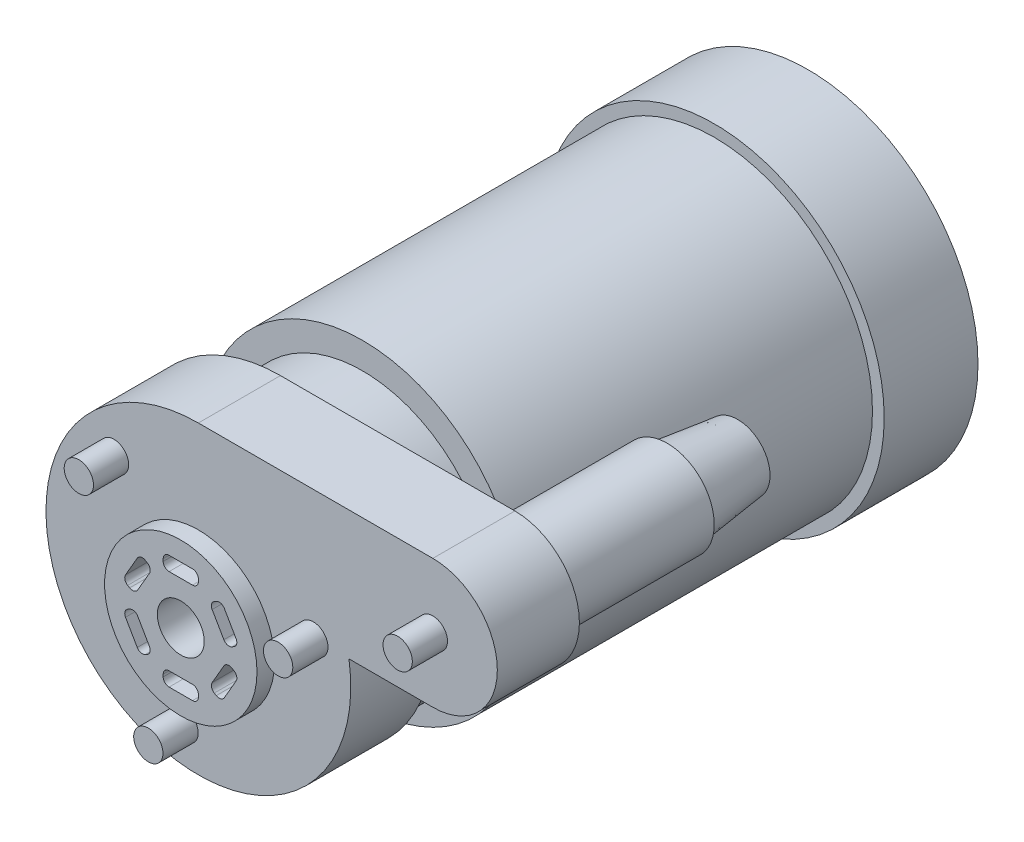
from build123d import *

# Parameters (mm, degrees)
EXTRUSION1_DEPTH        = 7
ESQUISSE2_R             = 1.25
EXTRUSION2_DEPTH        = 3
ESQUISSE3_R             = 6.5
EXTRUSION3_DEPTH        = 1.5
ENL_V_MAT_EXTRU_1_REACH = 31.858
ESQUISSE4_R             = 2
ESQUISSE5_R             = 11.25
EXTRUSION4_DEPTH        = 7
ESQUISSE6_R             = 13.5
EXTRUSION5_DEPTH        = 30
ESQUISSE7_R             = 14.5
EXTRUSION6_DEPTH        = 8
ESQUISSE8_R             = 4
EXTRUSION7_DEPTH        = 13
ESQUISSE9_R             = 3.5
EXTRUSION8_DEPTH        = 6
CHANFREIN1_SIZE2        = 0.736707365
CHANFREIN1_SIZE         = 6
COQUE1_START            = -44
COQUE1_2_OUTLINE_R      = 12.5
COQUE1_2_DEPTH          = 36
COQUE1_START_2          = -8
COQUE1_3_OUTLINE_R      = 10.25
COQUE1_3_DEPTH          = 14
COQUE1_START_3          = 1
COQUE1_4_OUTLINE_R      = 10.25
COQUE1_4_DEPTH          = 5
COQUE1_5_DEPTH          = 7
COQUE1_6_OUTLINE_R      = 13.5
COQUE1_6_OUTLINE_R_2    = 12.5
COQUE1_6_DEPTH          = 6
COQUE1_START_4          = 6
COQUE1_7_OUTLINE_R      = 0.25
COQUE1_7_DEPTH          = 1.5
COQUE1_START_5          = 7.5
COQUE1_8_OUTLINE_R      = 0.25
COQUE1_8_DEPTH          = 1.5


with BuildPart() as part:
    # Esquisse1 → Extrusion1 (new body)
    with BuildSketch(Plane.XY):
        with BuildLine():
            Line((0, 13), (20, 13))
            ThreePointArc((20, 13), (25.5, 7.5), (20, 2))
            Line((20, 2), (12.845232579, 2))
            ThreePointArc((12.845232579, 2), (-8.455767263, -9.874208829), (0, 13))
        make_face()
    extrude(amount=EXTRUSION1_DEPTH)

    # Esquisse2 → Extrusion2 (add)
    with BuildSketch(Plane.XY.offset(7)):
        with Locations((-7.195736182, 6.944161634)):
            Circle(ESQUISSE2_R)
        with Locations((-1.267918184, -9.919293497)):
            Circle(ESQUISSE2_R)
        with Locations((9.804601908, 1.967176005)):
            Circle(ESQUISSE2_R)
        with Locations((20, 7.5)):
            Circle(ESQUISSE2_R)
    extrude(amount=EXTRUSION2_DEPTH)

    # Esquisse3 → Extrusion3 (add)
    with BuildSketch(Plane.XY.offset(7)):
        with Locations((0, -1.390905973)):
            Circle(ESQUISSE3_R)
    extrude(amount=EXTRUSION3_DEPTH)

    # Esquisse4 → Enlèv. mat.-Extru.1 (cut, up to next)
    with BuildSketch(Plane.XY.offset(8.5), mode=Mode.PRIVATE) as enl_v_mat_extru_1_sk1:
        with Locations((0, -1.390905973)):
            Circle(ESQUISSE4_R)
    enl_v_mat_extru_1_tool1 = extrude(enl_v_mat_extru_1_sk1.sketch, amount=-ENL_V_MAT_EXTRU_1_REACH, mode=Mode.PRIVATE) & part.part
    # Esquisse4 → Enlèv. mat.-Extru.1 (cut, up to next)
    with BuildSketch(Plane.XY.offset(8.5), mode=Mode.PRIVATE) as enl_v_mat_extru_1_sk2:
        with BuildLine():
            Line((2.674824022, 1.308104934), (3.674824022, -0.423945873))
            ThreePointArc((3.674824022, -0.423945873), (3.978427201, -0.656908786), (4.357836723, -0.606958575))
            Line((4.357836723, -0.606958575), (4.531041804, -0.506958575))
            ThreePointArc((4.531041804, -0.506958575), (4.764004717, -0.203355396), (4.714054506, 0.176054127))
            Line((4.714054506, 0.176054127), (3.714054506, 1.908104934))
            ThreePointArc((3.714054506, 1.908104934), (3.410451327, 2.141067848), (3.031041804, 2.091117636))
            Line((3.031041804, 2.091117636), (2.857836723, 1.991117636))
            ThreePointArc((2.857836723, 1.991117636), (2.62487381, 1.687514457), (2.674824022, 1.308104934))
        make_face()
    enl_v_mat_extru_1_tool2 = extrude(enl_v_mat_extru_1_sk2.sketch, amount=-ENL_V_MAT_EXTRU_1_REACH, mode=Mode.PRIVATE) & part.part
    # Esquisse4 → Enlèv. mat.-Extru.1 (cut, up to next)
    with BuildSketch(Plane.XY.offset(8.5), mode=Mode.PRIVATE) as enl_v_mat_extru_1_sk3:
        with BuildLine():
            Line((-1, 3.475065034), (1, 3.475065034))
            ThreePointArc((1, 3.475065034), (1.353553391, 3.328618425), (1.5, 2.975065034))
            Line((1.5, 2.975065034), (1.5, 2.775065034))
            ThreePointArc((1.5, 2.775065034), (1.353553391, 2.421511644), (1, 2.275065034))
            Line((1, 2.275065034), (-1, 2.275065034))
            ThreePointArc((-1, 2.275065034), (-1.353553391, 2.421511644), (-1.5, 2.775065034))
            Line((-1.5, 2.775065034), (-1.5, 2.975065034))
            ThreePointArc((-1.5, 2.975065034), (-1.353553391, 3.328618425), (-1, 3.475065034))
        make_face()
    enl_v_mat_extru_1_tool3 = extrude(enl_v_mat_extru_1_sk3.sketch, amount=-ENL_V_MAT_EXTRU_1_REACH, mode=Mode.PRIVATE) & part.part
    # Esquisse4 → Enlèv. mat.-Extru.1 (cut, up to next)
    with BuildSketch(Plane.XY.offset(8.5), mode=Mode.PRIVATE) as enl_v_mat_extru_1_sk4:
        with BuildLine():
            Line((3.674824022, -2.357866073), (2.674824022, -4.08991688))
            ThreePointArc((2.674824022, -4.08991688), (2.62487381, -4.469326403), (2.857836723, -4.772929582))
            Line((2.857836723, -4.772929582), (3.031041804, -4.872929582))
            ThreePointArc((3.031041804, -4.872929582), (3.410451327, -4.922879793), (3.714054506, -4.68991688))
            Line((3.714054506, -4.68991688), (4.714054506, -2.957866073))
            ThreePointArc((4.714054506, -2.957866073), (4.764004717, -2.57845655), (4.531041804, -2.274853371))
            Line((4.531041804, -2.274853371), (4.357836723, -2.174853371))
            ThreePointArc((4.357836723, -2.174853371), (3.978427201, -2.124903159), (3.674824022, -2.357866073))
        make_face()
    enl_v_mat_extru_1_tool4 = extrude(enl_v_mat_extru_1_sk4.sketch, amount=-ENL_V_MAT_EXTRU_1_REACH, mode=Mode.PRIVATE) & part.part
    # Esquisse4 → Enlèv. mat.-Extru.1 (cut, up to next)
    with BuildSketch(Plane.XY.offset(8.5), mode=Mode.PRIVATE) as enl_v_mat_extru_1_sk5:
        with BuildLine():
            Line((1, -5.05687698), (-1, -5.05687698))
            ThreePointArc((-1, -5.05687698), (-1.353553391, -5.203323589), (-1.5, -5.55687698))
            Line((-1.5, -5.55687698), (-1.5, -5.75687698))
            ThreePointArc((-1.5, -5.75687698), (-1.353553391, -6.11043037), (-1, -6.25687698))
            Line((-1, -6.25687698), (1, -6.25687698))
            ThreePointArc((1, -6.25687698), (1.353553391, -6.11043037), (1.5, -5.75687698))
            Line((1.5, -5.75687698), (1.5, -5.55687698))
            ThreePointArc((1.5, -5.55687698), (1.353553391, -5.203323589), (1, -5.05687698))
        make_face()
    enl_v_mat_extru_1_tool5 = extrude(enl_v_mat_extru_1_sk5.sketch, amount=-ENL_V_MAT_EXTRU_1_REACH, mode=Mode.PRIVATE) & part.part
    # Esquisse4 → Enlèv. mat.-Extru.1 (cut, up to next)
    with BuildSketch(Plane.XY.offset(8.5), mode=Mode.PRIVATE) as enl_v_mat_extru_1_sk6:
        with BuildLine():
            Line((-2.674824022, -4.08991688), (-3.674824022, -2.357866073))
            ThreePointArc((-3.674824022, -2.357866073), (-3.978427201, -2.124903159), (-4.357836723, -2.174853371))
            Line((-4.357836723, -2.174853371), (-4.531041804, -2.274853371))
            ThreePointArc((-4.531041804, -2.274853371), (-4.764004717, -2.57845655), (-4.714054506, -2.957866073))
            Line((-4.714054506, -2.957866073), (-3.714054506, -4.68991688))
            ThreePointArc((-3.714054506, -4.68991688), (-3.410451327, -4.922879793), (-3.031041804, -4.872929582))
            Line((-3.031041804, -4.872929582), (-2.857836723, -4.772929582))
            ThreePointArc((-2.857836723, -4.772929582), (-2.62487381, -4.469326403), (-2.674824022, -4.08991688))
        make_face()
    enl_v_mat_extru_1_tool6 = extrude(enl_v_mat_extru_1_sk6.sketch, amount=-ENL_V_MAT_EXTRU_1_REACH, mode=Mode.PRIVATE) & part.part
    # Esquisse4 → Enlèv. mat.-Extru.1 (cut, up to next)
    with BuildSketch(Plane.XY.offset(8.5), mode=Mode.PRIVATE) as enl_v_mat_extru_1_sk7:
        with BuildLine():
            Line((-3.674824022, -0.423945873), (-2.674824022, 1.308104934))
            ThreePointArc((-2.674824022, 1.308104934), (-2.62487381, 1.687514457), (-2.857836723, 1.991117636))
            Line((-2.857836723, 1.991117636), (-3.031041804, 2.091117636))
            ThreePointArc((-3.031041804, 2.091117636), (-3.410451327, 2.141067848), (-3.714054506, 1.908104934))
            Line((-3.714054506, 1.908104934), (-4.714054506, 0.176054127))
            ThreePointArc((-4.714054506, 0.176054127), (-4.764004717, -0.203355396), (-4.531041804, -0.506958575))
            Line((-4.531041804, -0.506958575), (-4.357836723, -0.606958575))
            ThreePointArc((-4.357836723, -0.606958575), (-3.978427201, -0.656908786), (-3.674824022, -0.423945873))
        make_face()
    enl_v_mat_extru_1_tool7 = extrude(enl_v_mat_extru_1_sk7.sketch, amount=-ENL_V_MAT_EXTRU_1_REACH, mode=Mode.PRIVATE) & part.part
    add(enl_v_mat_extru_1_tool1.solids().sort_by_distance((0, -1.390906, 8.5))[0], mode=Mode.SUBTRACT)
    add(enl_v_mat_extru_1_tool2.solids().sort_by_distance((3.694439, 0.74208, 8.5))[0], mode=Mode.SUBTRACT)
    add(enl_v_mat_extru_1_tool3.solids().sort_by_distance((0, 2.875065, 8.5))[0], mode=Mode.SUBTRACT)
    add(enl_v_mat_extru_1_tool4.solids().sort_by_distance((3.694439, -3.523891, 8.5))[0], mode=Mode.SUBTRACT)
    add(enl_v_mat_extru_1_tool5.solids().sort_by_distance((0, -5.656877, 8.5))[0], mode=Mode.SUBTRACT)
    add(enl_v_mat_extru_1_tool6.solids().sort_by_distance((-3.694439, -3.523891, 8.5))[0], mode=Mode.SUBTRACT)
    add(enl_v_mat_extru_1_tool7.solids().sort_by_distance((-3.694439, 0.74208, 8.5))[0], mode=Mode.SUBTRACT)

    # Esquisse5 → Extrusion4 (add)
    with BuildSketch(Plane(origin=(0, 0, 0), x_dir=(-1, 0, 0), z_dir=(0, 0, -1))):
        with Locations(Location((0, -1.390905973, 0), (0, 0, 180))):
            Circle(ESQUISSE5_R)
    extrude(amount=EXTRUSION4_DEPTH)

    # Esquisse6 → Extrusion5 (add)
    with BuildSketch(Plane(origin=(0, 0, -7), x_dir=(-1, 0, 0), z_dir=(0, 0, -1))):
        with Locations((0, -1.390905973)):
            Circle(ESQUISSE6_R)
    extrude(amount=EXTRUSION5_DEPTH)

    # Esquisse7 → Extrusion6 (add)
    with BuildSketch(Plane(origin=(0, 0, -37), x_dir=(-1, 0, 0), z_dir=(0, 0, -1))):
        with Locations((0, -1.390905973)):
            Circle(ESQUISSE7_R)
    extrude(amount=EXTRUSION6_DEPTH)

    # Esquisse8 → Extrusion7 (add)
    with BuildSketch(Plane(origin=(0, 0, 0), x_dir=(-1, 0, 0), z_dir=(0, 0, -1))):
        with Locations(Location((-20, 7.5, 0), (0, 0, 180))):
            Circle(ESQUISSE8_R)
    extrude(amount=EXTRUSION7_DEPTH)

    # Esquisse9 → Extrusion8 (add)
    with BuildSketch(Plane(origin=(0, 0, -13), x_dir=(-1, 0, 0), z_dir=(0, 0, -1))):
        with Locations((-20, 7.5)):
            Circle(ESQUISSE9_R)
    extrude(amount=EXTRUSION8_DEPTH)

    # Chanfrein1
    chanfrein1_edges = [part.edges().sort_by_distance(p)[0] for p in [
        (23.5, 7.5, -19),
    ]]
    chanfrein1_side = [part.faces().sort_by_distance(p)[0] for p in [
        (23.5, 7.5, -18.985265853),
    ]]
    chamfer(chanfrein1_edges, length=CHANFREIN1_SIZE - 0.0001, length2=CHANFREIN1_SIZE2 - 0.0001, reference=chanfrein1_side[0])  # a hair under: the kernel refuses the full size

    # Coque1: read off the stored shape, not the designer's step
    # Coque1 outline → Coque1 (revolve, cut)
    with BuildSketch(Plane(origin=(20, 7.5, 0), x_dir=(1, 0, 0), z_dir=(0, -1, 0))):
        Polygon((1.755782809, -19), (2.615274735, -12), (3, -12), (3, 1), (4.5, 1), (4.5, 6), (0.25, 6), (0.25, 9), (0, 9), (0, -19), align=None)
    revolve(axis=Axis((20, 7.5, 0), (0, 0, 1)), mode=Mode.SUBTRACT)

    # Coque1 2 outline → Coque1 2 (cut)
    with BuildSketch(Plane.XY.offset(COQUE1_START)):
        with Locations((0, -1.390905973)):
            Circle(COQUE1_2_OUTLINE_R)
    extrude(amount=COQUE1_2_DEPTH, mode=Mode.SUBTRACT)

    # Coque1 3 outline → Coque1 3 (cut)
    # profile 1 of 7: a face of its own
    with BuildSketch(Plane.XY.offset(COQUE1_START_2)):
        with Locations((0, -1.390905973)):
            Circle(COQUE1_3_OUTLINE_R)
        with BuildLine():
            ThreePointArc((-2.531041804, -5.738954986), (-3.669270372, -5.88880562), (-4.58007991, -5.18991688))
            Line((-4.58007991, -5.18991688), (-5.58007991, -3.457866073))
            ThreePointArc((-5.58007991, -3.457866073), (-5.729930544, -2.319637505), (-5.031041804, -1.408827967))
            Line((-5.031041804, -1.408827967), (-5, -1.390905973))
            Line((-5, -1.390905973), (-5.031041804, -1.372983979))
            ThreePointArc((-5.031041804, -1.372983979), (-5.729930544, -0.462174441), (-5.58007991, 0.676054127))
            Line((-5.58007991, 0.676054127), (-4.58007991, 2.408104934))
            ThreePointArc((-4.58007991, 2.408104934), (-3.669270372, 3.106993674), (-2.531041804, 2.95714304))
            Line((-2.531041804, 2.95714304), (-2.5, 2.939221046))
            Line((-2.5, 2.939221046), (-2.5, 2.975065034))
            ThreePointArc((-2.5, 2.975065034), (-2.060660172, 4.035725206), (-1, 4.475065034))
            Line((-1, 4.475065034), (1, 4.475065034))
            ThreePointArc((1, 4.475065034), (2.060660172, 4.035725206), (2.5, 2.975065034))
            Line((2.5, 2.975065034), (2.5, 2.939221046))
            Line((2.5, 2.939221046), (2.531041804, 2.95714304))
            ThreePointArc((2.531041804, 2.95714304), (3.669270372, 3.106993674), (4.58007991, 2.408104934))
            Line((4.58007991, 2.408104934), (5.58007991, 0.676054127))
            ThreePointArc((5.58007991, 0.676054127), (5.729930544, -0.462174441), (5.031041804, -1.372983979))
            Line((5.031041804, -1.372983979), (5, -1.390905973))
            Line((5, -1.390905973), (5.031041804, -1.408827967))
            ThreePointArc((5.031041804, -1.408827967), (5.729930544, -2.319637505), (5.58007991, -3.457866073))
            Line((5.58007991, -3.457866073), (4.58007991, -5.18991688))
            ThreePointArc((4.58007991, -5.18991688), (3.669270372, -5.88880562), (2.531041804, -5.738954986))
            Line((2.531041804, -5.738954986), (2.5, -5.721032992))
            Line((2.5, -5.721032992), (2.5, -5.75687698))
            ThreePointArc((2.5, -5.75687698), (2.060660172, -6.817537152), (1, -7.25687698))
            Line((1, -7.25687698), (-1, -7.25687698))
            ThreePointArc((-1, -7.25687698), (-2.060660172, -6.817537152), (-2.5, -5.75687698))
            Line((-2.5, -5.75687698), (-2.5, -5.721032992))
            Line((-2.5, -5.721032992), (-2.531041804, -5.738954986))
        make_face(mode=Mode.SUBTRACT)
    # profile 2 of 7: a face of its own
    with BuildSketch(Plane.XY.offset(COQUE1_START_2)):
        with BuildLine():
            ThreePointArc((-3.230905645, -1.390905973), (-3.105891064, -1.491575387), (-2.992348972, -1.605026565))
            ThreePointArc((-2.992348972, -1.605026565), (-3, -1.390905972), (-2.992348972, -1.17678538))
            ThreePointArc((-2.992348972, -1.17678538), (-3.105891064, -1.290236559), (-3.230905645, -1.390905973))
        make_face()
    # profile 3 of 7: a face of its own
    with BuildSketch(Plane.XY.offset(COQUE1_START_2)):
        with BuildLine():
            ThreePointArc((-1.310740613, -4.089416496), (-1.5, -3.988982184), (-1.681608359, -3.875295903))
            ThreePointArc((-1.681608359, -3.875295903), (-1.640127802, -4.030351828), (-1.615452823, -4.188952339))
            ThreePointArc((-1.615452823, -4.188952339), (-1.465763262, -4.131021242), (-1.310740613, -4.089416496))
        make_face()
    # profile 4 of 7: a face of its own
    with BuildSketch(Plane.XY.offset(COQUE1_START_2)):
        with BuildLine():
            ThreePointArc((-1.681608359, 1.093483958), (-1.5, 1.207170239), (-1.310740613, 1.30760455))
            ThreePointArc((-1.310740613, 1.30760455), (-1.465763262, 1.349209297), (-1.615452823, 1.407140393))
            ThreePointArc((-1.615452823, 1.407140393), (-1.640127802, 1.248539883), (-1.681608359, 1.093483958))
        make_face()
    # profile 5 of 7: a face of its own
    with BuildSketch(Plane.XY.offset(COQUE1_START_2)):
        with BuildLine():
            ThreePointArc((1.310740613, 1.30760455), (1.5, 1.207170239), (1.681608359, 1.093483958))
            ThreePointArc((1.681608359, 1.093483958), (1.640127802, 1.248539883), (1.615452823, 1.407140393))
            ThreePointArc((1.615452823, 1.407140393), (1.465763262, 1.349209297), (1.310740613, 1.30760455))
        make_face()
    # profile 6 of 7: a face of its own
    with BuildSketch(Plane.XY.offset(COQUE1_START_2)):
        with BuildLine():
            ThreePointArc((2.992348972, -1.17678538), (3, -1.390905973), (2.992348972, -1.605026565))
            ThreePointArc((2.992348972, -1.605026565), (3.105891064, -1.491575387), (3.230905645, -1.390905973))
            ThreePointArc((3.230905645, -1.390905973), (3.105891064, -1.290236559), (2.992348972, -1.17678538))
        make_face()
    # profile 7 of 7: a face of its own
    with BuildSketch(Plane.XY.offset(COQUE1_START_2)):
        with BuildLine():
            ThreePointArc((1.681608359, -3.875295903), (1.5, -3.988982184), (1.310740613, -4.089416496))
            ThreePointArc((1.310740613, -4.089416496), (1.465763262, -4.131021242), (1.615452823, -4.188952339))
            ThreePointArc((1.615452823, -4.188952339), (1.640127802, -4.030351828), (1.681608359, -3.875295903))
        make_face()
    extrude(amount=COQUE1_3_DEPTH, mode=Mode.SUBTRACT)

    # Coque1 4 outline → Coque1 4 (cut)
    with BuildSketch(Plane.XY.offset(COQUE1_START_3)):
        with BuildLine():
            Line((11.618950039, 3), (20, 3))
            ThreePointArc((20, 3), (15.5, 7.5), (20, 12))
            Line((20, 12), (0, 12))
            ThreePointArc((0, 12), (-7.348469228, -9.486832981), (11.618950039, 3))
        make_face()
        with Locations((0, -1.390905973)):
            Circle(COQUE1_4_OUTLINE_R, mode=Mode.SUBTRACT)
    extrude(amount=COQUE1_4_DEPTH, mode=Mode.SUBTRACT)

    # Coque1 5 outline → Coque1 5 (cut)
    with BuildSketch(Plane.XY.offset(COQUE1_START_2)):
        with BuildLine():
            ThreePointArc((-2.5, -5.75687698), (-2.060660172, -6.817537152), (-1, -7.25687698))
            Line((-1, -7.25687698), (1, -7.25687698))
            ThreePointArc((1, -7.25687698), (2.060660172, -6.817537152), (2.5, -5.75687698))
            Line((2.5, -5.75687698), (2.5, -5.721032992))
            Line((2.5, -5.721032992), (2.531041804, -5.738954986))
            ThreePointArc((2.531041804, -5.738954986), (3.669270372, -5.88880562), (4.58007991, -5.18991688))
            Line((4.58007991, -5.18991688), (5.58007991, -3.457866073))
            ThreePointArc((5.58007991, -3.457866073), (5.729930544, -2.319637505), (5.031041804, -1.408827967))
            Line((5.031041804, -1.408827967), (5, -1.390905973))
            Line((5, -1.390905973), (5.031041804, -1.372983979))
            ThreePointArc((5.031041804, -1.372983979), (5.729930544, -0.462174441), (5.58007991, 0.676054127))
            Line((5.58007991, 0.676054127), (4.58007991, 2.408104934))
            ThreePointArc((4.58007991, 2.408104934), (3.669270372, 3.106993674), (2.531041804, 2.95714304))
            Line((2.531041804, 2.95714304), (2.5, 2.939221046))
            Line((2.5, 2.939221046), (2.5, 2.975065034))
            ThreePointArc((2.5, 2.975065034), (2.060660172, 4.035725206), (1, 4.475065034))
            Line((1, 4.475065034), (-1, 4.475065034))
            ThreePointArc((-1, 4.475065034), (-2.060660172, 4.035725206), (-2.5, 2.975065034))
            Line((-2.5, 2.975065034), (-2.5, 2.939221046))
            Line((-2.5, 2.939221046), (-2.531041804, 2.95714304))
            ThreePointArc((-2.531041804, 2.95714304), (-3.669270372, 3.106993674), (-4.58007991, 2.408104934))
            Line((-4.58007991, 2.408104934), (-5.58007991, 0.676054127))
            ThreePointArc((-5.58007991, 0.676054127), (-5.729930544, -0.462174441), (-5.031041804, -1.372983979))
            Line((-5.031041804, -1.372983979), (-5, -1.390905973))
            Line((-5, -1.390905973), (-5.031041804, -1.408827967))
            ThreePointArc((-5.031041804, -1.408827967), (-5.729930544, -2.319637505), (-5.58007991, -3.457866073))
            Line((-5.58007991, -3.457866073), (-4.58007991, -5.18991688))
            ThreePointArc((-4.58007991, -5.18991688), (-3.669270372, -5.88880562), (-2.531041804, -5.738954986))
            Line((-2.531041804, -5.738954986), (-2.5, -5.721032992))
            Line((-2.5, -5.721032992), (-2.5, -5.75687698))
        make_face()
        with BuildLine():
            ThreePointArc((-1.615452823, -4.188952339), (-1.640127802, -4.030351828), (-1.681608359, -3.875295903))
            ThreePointArc((-1.681608359, -3.875295903), (-1.5, -3.988982184), (-1.310740613, -4.089416496))
            ThreePointArc((-1.310740613, -4.089416496), (-1.465763262, -4.131021242), (-1.615452823, -4.188952339))
        make_face(mode=Mode.SUBTRACT)
        with BuildLine():
            ThreePointArc((1.615452823, -4.188952339), (1.465763262, -4.131021242), (1.310740613, -4.089416496))
            ThreePointArc((1.310740613, -4.089416496), (1.5, -3.988982184), (1.681608359, -3.875295903))
            ThreePointArc((1.681608359, -3.875295903), (1.640127802, -4.030351828), (1.615452823, -4.188952339))
        make_face(mode=Mode.SUBTRACT)
        with BuildLine():
            ThreePointArc((-2.992348972, -1.17678538), (-3, -1.390905972), (-2.992348972, -1.605026565))
            ThreePointArc((-2.992348972, -1.605026565), (-3.105891064, -1.491575387), (-3.230905645, -1.390905973))
            ThreePointArc((-3.230905645, -1.390905973), (-3.105891064, -1.290236559), (-2.992348972, -1.17678538))
        make_face(mode=Mode.SUBTRACT)
        with BuildLine():
            ThreePointArc((-1.615452823, 1.407140393), (-1.465763262, 1.349209297), (-1.310740613, 1.30760455))
            ThreePointArc((-1.310740613, 1.30760455), (-1.5, 1.207170239), (-1.681608359, 1.093483958))
            ThreePointArc((-1.681608359, 1.093483958), (-1.640127802, 1.248539883), (-1.615452823, 1.407140393))
        make_face(mode=Mode.SUBTRACT)
        with BuildLine():
            ThreePointArc((3.230905645, -1.390905973), (3.105891064, -1.491575387), (2.992348972, -1.605026565))
            ThreePointArc((2.992348972, -1.605026565), (3, -1.390905973), (2.992348972, -1.17678538))
            ThreePointArc((2.992348972, -1.17678538), (3.105891064, -1.290236559), (3.230905645, -1.390905973))
        make_face(mode=Mode.SUBTRACT)
        with BuildLine():
            ThreePointArc((1.615452823, 1.407140393), (1.640127802, 1.248539883), (1.681608359, 1.093483958))
            ThreePointArc((1.681608359, 1.093483958), (1.5, 1.207170239), (1.310740613, 1.30760455))
            ThreePointArc((1.310740613, 1.30760455), (1.465763262, 1.349209297), (1.615452823, 1.407140393))
        make_face(mode=Mode.SUBTRACT)
    extrude(amount=COQUE1_5_DEPTH, mode=Mode.SUBTRACT)

    # Coque1 6 outline → Coque1 6 (cut)
    with BuildSketch(Plane.XY.offset(COQUE1_START)):
        with Locations((0, -1.390905973)):
            Circle(COQUE1_6_OUTLINE_R)
        with Locations((0, -1.390905973)):
            Circle(COQUE1_6_OUTLINE_R_2, mode=Mode.SUBTRACT)
    extrude(amount=COQUE1_6_DEPTH, mode=Mode.SUBTRACT)

    # Coque1 7 outline → Coque1 7 (cut)
    with BuildSketch(Plane.XY.offset(COQUE1_START_4)):
        with BuildLine():
            ThreePointArc((-3.10632939, -5.929707326), (-2.75, -6.154045694), (-2.37755258, -6.350466813))
            ThreePointArc((-2.37755258, -6.350466813), (-2.469069241, -6.059920814), (-2.5, -5.75687698))
            Line((-2.5, -5.75687698), (-2.5, -5.721032992))
            Line((-2.5, -5.721032992), (-2.531041804, -5.738954986))
            ThreePointArc((-2.531041804, -5.738954986), (-2.808950842, -5.86369008), (-3.10632939, -5.929707326))
        make_face()
        with BuildLine():
            ThreePointArc((2.5, -5.75687698), (2.469069241, -6.059920814), (2.37755258, -6.350466813))
            ThreePointArc((2.37755258, -6.350466813), (2.75, -6.154045694), (3.10632939, -5.929707326))
            ThreePointArc((3.10632939, -5.929707326), (2.808950842, -5.86369008), (2.531041804, -5.738954986))
            Line((2.531041804, -5.738954986), (2.5, -5.721032992))
            Line((2.5, -5.721032992), (2.5, -5.75687698))
        make_face()
        with BuildLine():
            ThreePointArc((-5.483881969, -0.970146485), (-5.5, -1.390905972), (-5.483881969, -1.81166546))
            ThreePointArc((-5.483881969, -1.81166546), (-5.278020083, -1.587136707), (-5.031041804, -1.408827967))
            Line((-5.031041804, -1.408827967), (-5, -1.390905973))
            Line((-5, -1.390905973), (-5.031041804, -1.372983979))
            ThreePointArc((-5.031041804, -1.372983979), (-5.278020083, -1.194675239), (-5.483881969, -0.970146485))
        make_face()
        with BuildLine():
            ThreePointArc((5.031041804, -1.408827967), (5.278020083, -1.587136707), (5.483881969, -1.81166546))
            ThreePointArc((5.483881969, -1.81166546), (5.5, -1.390905973), (5.483881969, -0.970146485))
            ThreePointArc((5.483881969, -0.970146485), (5.278020083, -1.194675239), (5.031041804, -1.372983979))
            Line((5.031041804, -1.372983979), (5, -1.390905973))
            Line((5, -1.390905973), (5.031041804, -1.408827967))
        make_face()
        with BuildLine():
            ThreePointArc((-2.37755258, 3.568654868), (-2.75, 3.372233748), (-3.10632939, 3.14789538))
            ThreePointArc((-3.10632939, 3.14789538), (-2.808950842, 3.081878134), (-2.531041804, 2.95714304))
            Line((-2.531041804, 2.95714304), (-2.5, 2.939221046))
            Line((-2.5, 2.939221046), (-2.5, 2.975065034))
            ThreePointArc((-2.5, 2.975065034), (-2.469069241, 3.278108868), (-2.37755258, 3.568654868))
        make_face()
        with BuildLine():
            ThreePointArc((2.531041804, 2.95714304), (2.808950842, 3.081878134), (3.10632939, 3.14789538))
            ThreePointArc((3.10632939, 3.14789538), (2.75, 3.372233748), (2.37755258, 3.568654868))
            ThreePointArc((2.37755258, 3.568654868), (2.469069241, 3.278108868), (2.5, 2.975065034))
            Line((2.5, 2.975065034), (2.5, 2.939221046))
            Line((2.5, 2.939221046), (2.531041804, 2.95714304))
        make_face()
        with BuildLine():
            ThreePointArc((-3.230905645, -1.390905973), (-3.105891064, -1.491575387), (-2.992348972, -1.605026565))
            ThreePointArc((-2.992348972, -1.605026565), (-3, -1.390905972), (-2.992348972, -1.17678538))
            ThreePointArc((-2.992348972, -1.17678538), (-3.105891064, -1.290236559), (-3.230905645, -1.390905973))
        make_face()
        with BuildLine():
            ThreePointArc((-1.310740613, -4.089416496), (-1.5, -3.988982184), (-1.681608359, -3.875295903))
            ThreePointArc((-1.681608359, -3.875295903), (-1.640127802, -4.030351828), (-1.615452823, -4.188952339))
            ThreePointArc((-1.615452823, -4.188952339), (-1.465763262, -4.131021242), (-1.310740613, -4.089416496))
        make_face()
        with BuildLine():
            ThreePointArc((-1.681608359, 1.093483958), (-1.5, 1.207170239), (-1.310740613, 1.30760455))
            ThreePointArc((-1.310740613, 1.30760455), (-1.465763262, 1.349209297), (-1.615452823, 1.407140393))
            ThreePointArc((-1.615452823, 1.407140393), (-1.640127802, 1.248539883), (-1.681608359, 1.093483958))
        make_face()
        with BuildLine():
            ThreePointArc((1.310740613, 1.30760455), (1.5, 1.207170239), (1.681608359, 1.093483958))
            ThreePointArc((1.681608359, 1.093483958), (1.640127802, 1.248539883), (1.615452823, 1.407140393))
            ThreePointArc((1.615452823, 1.407140393), (1.465763262, 1.349209297), (1.310740613, 1.30760455))
        make_face()
        with BuildLine():
            ThreePointArc((2.992348972, -1.17678538), (3, -1.390905973), (2.992348972, -1.605026565))
            ThreePointArc((2.992348972, -1.605026565), (3.105891064, -1.491575387), (3.230905645, -1.390905973))
            ThreePointArc((3.230905645, -1.390905973), (3.105891064, -1.290236559), (2.992348972, -1.17678538))
        make_face()
        with BuildLine():
            ThreePointArc((1.681608359, -3.875295903), (1.5, -3.988982184), (1.310740613, -4.089416496))
            ThreePointArc((1.310740613, -4.089416496), (1.465763262, -4.131021242), (1.615452823, -4.188952339))
            ThreePointArc((1.615452823, -4.188952339), (1.640127802, -4.030351828), (1.681608359, -3.875295903))
        make_face()
        with Locations((-7.195736182, 6.944161634)):
            Circle(COQUE1_7_OUTLINE_R)
        with Locations((-1.267918184, -9.919293497)):
            Circle(COQUE1_7_OUTLINE_R)
        with Locations((9.804601908, 1.967176005)):
            Circle(COQUE1_7_OUTLINE_R)
    extrude(amount=COQUE1_7_DEPTH, mode=Mode.SUBTRACT)

    # Coque1 8 outline → Coque1 8 (cut)
    with BuildSketch(Plane.XY.offset(COQUE1_START_5)):
        with Locations((-7.195736182, 6.944161634)):
            Circle(COQUE1_8_OUTLINE_R)
        with Locations((-1.267918184, -9.919293497)):
            Circle(COQUE1_8_OUTLINE_R)
        with Locations((9.804601908, 1.967176005)):
            Circle(COQUE1_8_OUTLINE_R)
    extrude(amount=COQUE1_8_DEPTH, mode=Mode.SUBTRACT)


solid = part.part
